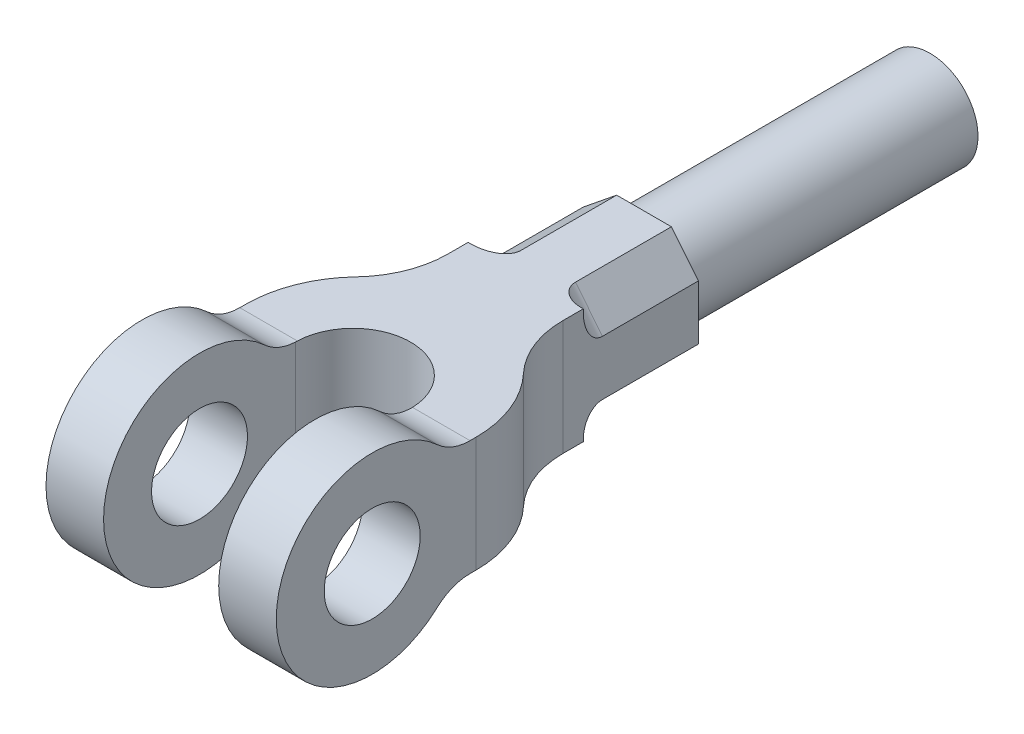
from build123d import *

# Parameters (mm, degrees)
SKETCH1_W           = 1200
SKETCH1_H           = 2500
BOSS_EXTRUDE1_DEPTH = 1000
CUT_EXTRUDE1_DEPTH  = 1710.532099728
SKETCH3_R           = 250
CUT_EXTRUDE2_DEPTH  = 2001.624902374
FILLET1_R           = 250
CUT_EXTRUDE3_DEPTH  = 600
SKETCH4_3_R         = 250
BOSS_EXTRUDE2_DEPTH = 1507
FILLET6_R           = 100
FILLET7_R           = 100


with BuildPart() as part:
    # Sketch1 → Boss-Extrude1 (new body)
    with BuildSketch(Plane(origin=(0, 0, 0), x_dir=(1, 0, 0), z_dir=(0, 1, 0))):
        Rectangle(SKETCH1_W, SKETCH1_H)
    extrude(amount=BOSS_EXTRUDE1_DEPTH)

    # Sketch2 → Cut-Extrude1 (cut, through all)
    with BuildSketch(Plane(origin=(0, 1000, 0), x_dir=(1, 0, 0), z_dir=(0, 1, 0))):
        with BuildLine():
            ThreePointArc((300, -250), (0, 50), (-300, -250))
            Line((-300, -250), (-300, -1250))
            Line((-300, -1250), (300, -1250))
            Line((300, -1250), (300, -250))
        make_face()
        with BuildLine():
            Line((600, 1250), (300, 1250))
            Line((300, 1250), (300, 544.983443527))
            ThreePointArc((300, 544.983443527), (335.339811358, 360.346207058), (436.363636364, 201.809151015))
            ThreePointArc((436.363636364, 201.809151015), (557.592227317, 11.564681381), (600, -210.000005126))
            Line((600, -210.000005126), (600, 1250))
        make_face()
        with BuildLine():
            Line((-300, 544.983443527), (-300, 1250))
            Line((-300, 1250), (-600, 1250))
            Line((-600, 1250), (-600, -209.999997708))
            ThreePointArc((-600, -209.999997708), (-557.592225947, 11.564684828), (-436.363636364, 201.809151015))
            ThreePointArc((-436.363636364, 201.809151015), (-335.339811358, 360.346207058), (-300, 544.983443527))
        make_face()
    extrude(amount=-CUT_EXTRUDE1_DEPTH, mode=Mode.SUBTRACT)

    # Sketch3 → Cut-Extrude2 (cut, through all)
    with BuildSketch(Plane(origin=(600, 0, 0), x_dir=(0, 0, -1), z_dir=(1, 0, 0))):
        with BuildLine():
            Line((1250, 800), (1250, 1000))
            Line((1250, 1000), (-750, 1000))
            ThreePointArc((-750, 1000), (-526.39320225, 947.2135955), (-350, 800))
            Line((-350, 800), (1250, 800))
        make_face()
        with BuildLine():
            Line((1250, 0), (1250, 200))
            Line((1250, 200), (-350, 200))
            ThreePointArc((-350, 200), (-526.39320225, 52.7864045), (-750, 0))
            Line((-750, 0), (1250, 0))
        make_face()
        with BuildLine():
            ThreePointArc((-1250, 500), (-1103.553390593, 853.553390593), (-750, 1000))
            Line((-750, 1000), (-1250, 1000))
            Line((-1250, 1000), (-1250, 500))
        make_face()
        with BuildLine():
            ThreePointArc((-750, 0), (-1103.553390593, 146.446609407), (-1250, 500))
            Line((-1250, 500), (-1250, 0))
            Line((-1250, 0), (-750, 0))
        make_face()
        with Locations((-750, 500)):
            Circle(SKETCH3_R)
    extrude(amount=-CUT_EXTRUDE2_DEPTH, mode=Mode.SUBTRACT)

    # Fillet1
    fillet1_edges = [part.edges().sort_by_distance(p)[0] for p in [
        (450, 200, 350),
    ]]
    fillet(fillet1_edges, radius=FILLET1_R)
    fillet1_2_edges = [part.edges().sort_by_distance(p)[0] for p in [
        (450, 800, 350),
    ]]
    fillet(fillet1_2_edges, radius=FILLET1_R)
    fillet1_3_edges = [part.edges().sort_by_distance(p)[0] for p in [
        (-450, 800, 350),
    ]]
    fillet(fillet1_3_edges, radius=FILLET1_R)
    fillet1_4_edges = [part.edges().sort_by_distance(p)[0] for p in [
        (-450, 200, 350),
    ]]
    fillet(fillet1_4_edges, radius=FILLET1_R)

    # Sketch4 → Cut-Extrude3 (cut)
    with BuildSketch(Plane(origin=(0, 0, -1250), x_dir=(-1, 0, 0), z_dir=(0, 0, -1))):
        Polygon((300, 659.323834087), (300, 800), (126, 800), align=None)
        Polygon((-300, 626), (-159.323834087, 800), (-300, 800), align=None)
        Polygon((300, 200), (300, 374), (159.323834087, 200), align=None)
        Polygon((-126, 200), (-300, 340.676165913), (-300, 200), align=None)
    extrude(amount=-CUT_EXTRUDE3_DEPTH, mode=Mode.SUBTRACT)

    # Sketch4<3> → Boss-Extrude2 (add)
    with BuildSketch(Plane(origin=(0, 0, -1250), x_dir=(-1, 0, 0), z_dir=(0, 0, -1))):
        with Locations((0, 500)):
            Circle(SKETCH4_3_R)
    extrude(amount=BOSS_EXTRUDE2_DEPTH)

    # Fillet6
    fillet6_edges = [part.edges().sort_by_distance(p)[0] for p in [
        (-213, 729.661917043, -650),
    ]]
    fillet(fillet6_edges, radius=FILLET6_R)

    # Fillet7
    fillet7_edges = [part.edges().sort_by_distance(p)[0] for p in [
        (229.661917043, 713, -650),
        (213, 270.338082957, -650),
        (-229.661917043, 287, -650),
    ]]
    fillet(fillet7_edges, radius=FILLET7_R)


solid = part.part
